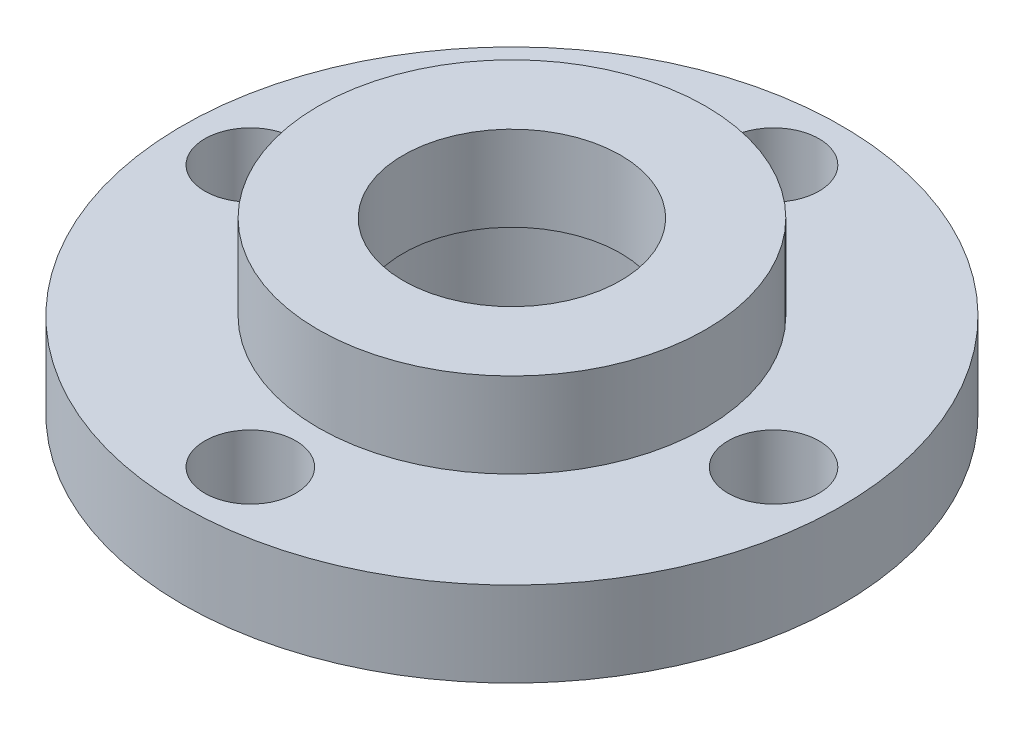
from build123d import *

# Parameters (mm, degrees)
SKETCH1_R           = 7.239
SKETCH1_R_2         = 4.064
BOSS_EXTRUDE1_DEPTH = 6.35
SKETCH1_3_R         = 12.319
SKETCH1_3_R_2       = 7.239
BOSS_EXTRUDE2_DEPTH = 3.175
SKETCH2_R           = 1.7
CUT_EXTRUDE1_DEPTH  = 3.175
SKETCH7_R           = 4.8895
CUT_EXTRUDE3_DEPTH  = 3.175


with BuildPart() as part:
    # Sketch1 → Boss-Extrude1 (new body)
    with BuildSketch(Plane(origin=(0, 0, 0), x_dir=(1, 0, 0), z_dir=(0, 1, 0))):
        Circle(SKETCH1_R)
        Circle(SKETCH1_R_2, mode=Mode.SUBTRACT)
    extrude(amount=BOSS_EXTRUDE1_DEPTH)

    # Sketch1<3> → Boss-Extrude2 (add)
    with BuildSketch(Plane(origin=(0, 0, 0), x_dir=(1, 0, 0), z_dir=(0, 1, 0))):
        Circle(SKETCH1_3_R)
        Circle(SKETCH1_3_R_2, mode=Mode.SUBTRACT)
    extrude(amount=BOSS_EXTRUDE2_DEPTH)

    # Sketch2 → Cut-Extrude1 (cut)
    with BuildSketch(Plane(origin=(0, 3.175, 0), x_dir=(1, 0, 0), z_dir=(0, 1, 0))):
        with Locations((0, 9.779)):
            Circle(SKETCH2_R)
        with Locations((9.779, 0)):
            Circle(SKETCH2_R)
        with Locations((0, -9.779)):
            Circle(SKETCH2_R)
        with Locations((-9.779, 0)):
            Circle(SKETCH2_R)
    extrude(amount=-CUT_EXTRUDE1_DEPTH, mode=Mode.SUBTRACT)

    # Sketch7 → Cut-Extrude3 (cut)
    with BuildSketch(Plane.XZ):
        Circle(SKETCH7_R)
    extrude(amount=-CUT_EXTRUDE3_DEPTH, mode=Mode.SUBTRACT)


solid = part.part
